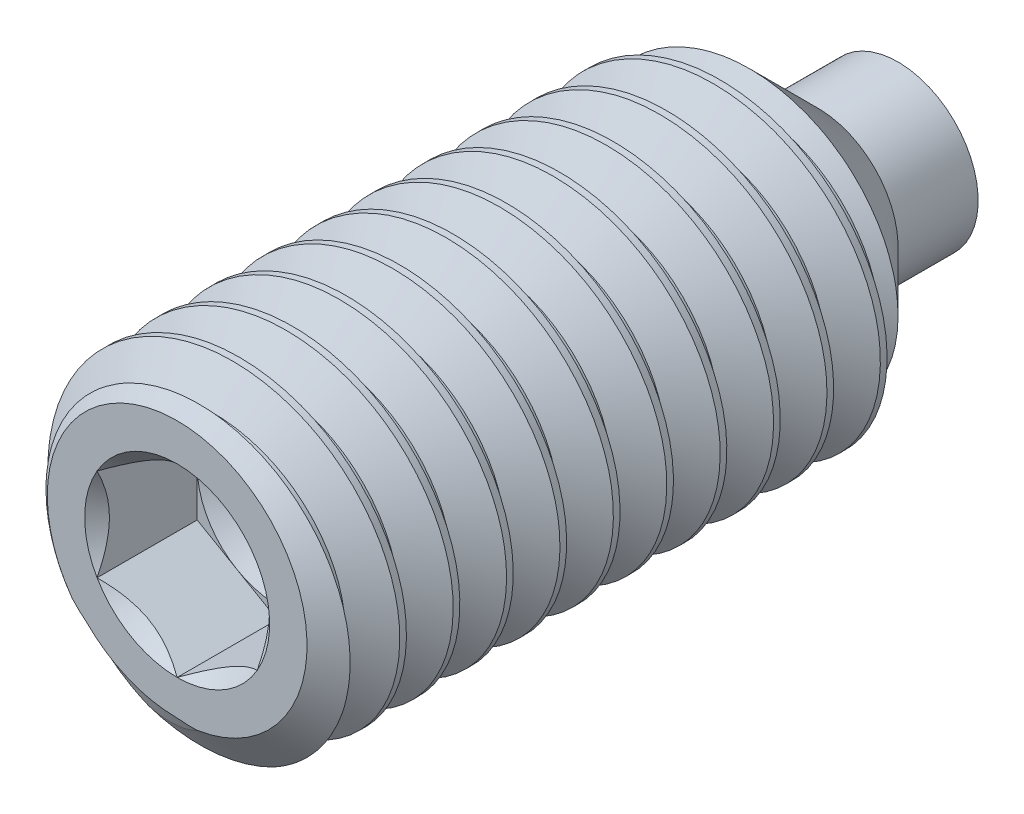
from build123d import *

# Parameters (mm, degrees)
CUT_SWEEP2_PITCH    = 0.79375
CUT_EXTRUDE10_DEPTH = 1.48828125


with BuildPart() as part:
    # Sketch22 → Revolve1 (revolve)
    with BuildSketch(Plane(origin=(0, 0, 0), x_dir=(0, 0, -1), z_dir=(1, 0, 0)), mode=Mode.PRIVATE) as revolve1_sk:
        Polygon((-5.3578125, 0), (-5.3578125, 1.9304), (-5.019892342, 2.413), (2.9448125, 2.413), (4.1671875, 1.190625), (5.3578125, 1.190625), (5.3578125, 0), align=None)
    revolve(revolve1_sk.sketch.rotate(Axis((0, 0, -5.3578125), (0, 0, 1)), 90), axis=Axis((0, 0, -5.3578125), (0, 0, 1)))

    # Cut-Sweep2: the profile of Sketch28 profile screwed along a right-hand helix of 13 turns, 8 arcs to a turn; built about Z, then put on its axis
    cut_sweep2_z = Axis((0, 0, 0), (0, 0, 1))
    cut_sweep2_corners = [(2.4133, 0, 0.000173205), (2.4133, 0, -0.694704455), (1.897444252, 0, -0.396875), (1.897444252, 0, -0.29765625)]
    with BuildLine(mode=Mode.PRIVATE) as cut_sweep2_profile:
        Line(cut_sweep2_corners[0], cut_sweep2_corners[1])
        Line(cut_sweep2_corners[1], cut_sweep2_corners[2])
        Line(cut_sweep2_corners[2], cut_sweep2_corners[3])
        Line(cut_sweep2_corners[3], cut_sweep2_corners[0])
    cut_sweep2_cap = Face(cut_sweep2_profile.wire())
    cut_sweep2_turn_angles = [0, 22.5, 45, 67.5, 90, 112.5, 135, 157.5, 180, 202.5, 225, 247.5, 270, 292.5, 315, 337.5, 360]
    cut_sweep2_turn_weights = [1, 0.9238795325112867, 1, 0.9238795325112867, 1, 0.9238795325112867, 1, 0.9238795325112867, 1, 0.9238795325112867, 1, 0.9238795325112867, 1, 0.9238795325112867, 1, 0.9238795325112867, 1]
    cut_sweep2_turn_rails = [Edge.make_bspline([Vector(p[0], p[1], 0).rotate(cut_sweep2_z, cut_sweep2_turn_angles[k]) / cut_sweep2_turn_weights[k] + Vector(0, 0, p[2] + CUT_SWEEP2_PITCH * cut_sweep2_turn_angles[k] / 360) for k in range(17)], [0, 0, 0, 1, 1, 2, 2, 3, 3, 4, 4, 5, 5, 6, 6, 7, 7, 8, 8, 8], 2, cut_sweep2_turn_weights) for p in cut_sweep2_corners]
    cut_sweep2_turn_sides = [Face.make_surface_from_curves(cut_sweep2_turn_rails[p[0]], cut_sweep2_turn_rails[p[1]]) for p in [(0, 1), (1, 2), (2, 3), (3, 0)]]
    cut_sweep2 = Plane(origin=(0, 0, -4.1671875), x_dir=(0, 1, 0), z_dir=(0, 0, 1)) * Solid(Shell([*[p.moved(Location((0, 0, CUT_SWEEP2_PITCH * i))) for i in range(13) for p in cut_sweep2_turn_sides], cut_sweep2_cap, cut_sweep2_cap.rotate(cut_sweep2_z, 4680).moved(Location((0, 0, CUT_SWEEP2_PITCH * 4680 / 360)))]))
    add(cut_sweep2, mode=Mode.SUBTRACT)

    # Sketch23 → Cut-Extrude10 (cut)
    with BuildSketch(Plane.XY.offset(5.3578125)):
        Polygon((0, 1.374815329), (-1.190625, 0.687407664), (-1.190625, -0.687407664), (0, -1.374815329), (1.190625, -0.687407664), (1.190625, 0.687407664), align=None)
    extrude(amount=-CUT_EXTRUDE10_DEPTH, mode=Mode.SUBTRACT)

    # Cut-Extrude11 cone 1 section (through the dimple's axis) → Cut-Extrude11 (revolve, cut)
    with BuildSketch(Plane(origin=(0, 0, 5.3578125), x_dir=(0, -1, 0), z_dir=(1, 0, 0))):
        Polygon((0, 0), (1.374815329, 0), (0, 1.374815329), align=None)
    revolve(axis=Axis((0, 0, 5.3578125), (0, 0, -1)), mode=Mode.SUBTRACT)

    # Cut-Extrude12 cone 1 section (through the dimple's axis) → Cut-Extrude12 (revolve, cut)
    with BuildSketch(Plane(origin=(0, 0, 3.86953125), x_dir=(0, -1, 0), z_dir=(1, 0, 0))):
        Polygon((0, 0), (1.190625, 0), (0, 0.687407664), align=None)
    revolve(axis=Axis((0, 0, 3.86953125), (0, 0, -1)), mode=Mode.SUBTRACT)


solid = part.part
